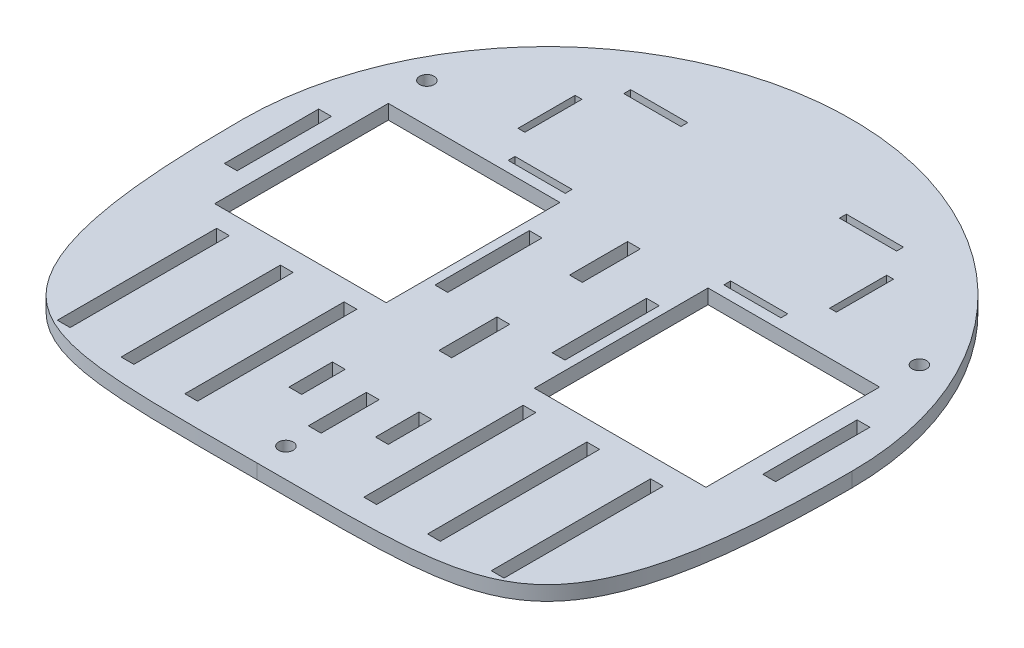
from build123d import *

# Parameters (mm, degrees)
BASE_DEPTH            = 6.35
SKETCH6_W             = 75.0815
SKETCH6_H             = 76
SKETCH6_W_2           = 5.588
SKETCH6_H_2           = 41.275
WHEELSHAFTCUT_DEPTH   = 189.692256213
SKETCH8_W             = 5.588
SKETCH8_H             = 69.7
SKETCH8_H_2           = 19.05
MOTORCUT_DEPTH        = 189.692256213
SKETCH10_W            = 25
SKETCH10_H            = 3
SKETCH10_W_2          = 3
SKETCH10_H_2          = 25
VELCROCUT_DEPTH       = 189.692256213
SKETCH11_R            = 3.175
SCREWCUT_DEPTH        = 189.692256213
SKETCH13_W            = 5.588
SKETCH13_H            = 25.4
SUPPORTSTRUTCUT_DEPTH = 189.692256213


with BuildPart() as part:
    # Sketch1 → Base (new body)
    with BuildSketch(Plane(origin=(0, 0, 0), x_dir=(1, 0, 0), z_dir=(0, 1, 0))):
        with BuildLine():
            ThreePointArc((133.35, 0), (0, 133.35), (-133.35, 0))
            add(Edge.make_bspline(
                [(-133.35, 0), (-133.35, -51.197979728), (-123.803376308, -129.805052089), (-58.427993604, -127), (0, -127)],
                knots=[0, 0, 0, 0, 0.502616309, 1, 1, 1, 1], degree=3))
            add(Edge.make_bspline(
                [(133.35, 0), (133.35, -51.197979728), (123.803376308, -129.805052089), (58.427993604, -127), (0, -127)],
                knots=[0, 0, 0, 0, 0.502616309, 1, 1, 1, 1], degree=3))
        make_face()
    extrude(amount=BASE_DEPTH)

    # Sketch6 → WheelShaftCut (cut, through all)
    with BuildSketch(Plane(origin=(0, 6.35, 0), x_dir=(1, 0, 0), z_dir=(0, 1, 0))):
        with Locations((-69.957348141, 0)):
            Rectangle(SKETCH6_W, SKETCH6_H)
        with Locations((-117.816848141, 0)):
            Rectangle(SKETCH6_W_2, SKETCH6_H_2)
        with Locations((-25.653848141, 0)):
            Rectangle(SKETCH6_W_2, SKETCH6_H_2)
        with Locations((25.653848141, 0)):
            Rectangle(SKETCH6_W_2, SKETCH6_H_2)
        with Locations((117.816848141, 0)):
            Rectangle(SKETCH6_W_2, SKETCH6_H_2)
        with Locations((69.957348141, 0)):
            Rectangle(SKETCH6_W, SKETCH6_H)
    extrude(amount=-WHEELSHAFTCUT_DEPTH, mode=Mode.SUBTRACT)

    # Sketch8 → MotorCut (cut, through all)
    with BuildSketch(Plane(origin=(0, 6.35, 0), x_dir=(1, 0, 0), z_dir=(0, 1, 0))):
        with Locations((-39.174460242, -81.74)):
            Rectangle(SKETCH8_W, SKETCH8_H)
        with Locations((-67.057904192, -81.74)):
            Rectangle(SKETCH8_W, SKETCH8_H)
        with Locations((-94.941348141, -81.74)):
            Rectangle(SKETCH8_W, SKETCH8_H)
        with Locations((18.941348141, -81.74)):
            Rectangle(SKETCH8_W, SKETCH8_H_2)
        with Locations((94.941348141, -81.74)):
            Rectangle(SKETCH8_W, SKETCH8_H)
        with Locations((67.057904192, -81.74)):
            Rectangle(SKETCH8_W, SKETCH8_H)
        with Locations((-18.941348141, -81.74)):
            Rectangle(SKETCH8_W, SKETCH8_H_2)
        with Locations((39.174460242, -81.74)):
            Rectangle(SKETCH8_W, SKETCH8_H)
    extrude(amount=-MOTORCUT_DEPTH, mode=Mode.SUBTRACT)

    # Sketch10 → VelcroCut (cut, through all)
    with BuildSketch(Plane(origin=(0, 6.35, 0), x_dir=(1, 0, 0), z_dir=(0, 1, 0))):
        with Locations((-47.19, 44.12)):
            Rectangle(SKETCH10_W, SKETCH10_H)
        with Locations((-47.19, 94.745)):
            Rectangle(SKETCH10_W, SKETCH10_H)
        with Locations((-68.175, 69.4325)):
            Rectangle(SKETCH10_W_2, SKETCH10_H_2)
        with Locations((68.175, 69.4325)):
            Rectangle(SKETCH10_W_2, SKETCH10_H_2)
        with Locations((47.19, 94.745)):
            Rectangle(SKETCH10_W, SKETCH10_H)
        with Locations((47.19, 44.12)):
            Rectangle(SKETCH10_W, SKETCH10_H)
    extrude(amount=-VELCROCUT_DEPTH, mode=Mode.SUBTRACT)

    # Sketch11 → ScrewCut (cut, through all)
    with BuildSketch(Plane(origin=(0, 6.35, 0), x_dir=(1, 0, 0), z_dir=(0, 1, 0))):
        with Locations((0, -114.3)):
            Circle(SKETCH11_R)
        with Locations((-107.775, 55.145)):
            Circle(SKETCH11_R)
        with Locations((107.775, 55.145)):
            Circle(SKETCH11_R)
    extrude(amount=-SCREWCUT_DEPTH, mode=Mode.SUBTRACT)

    # Sketch13 → SupportStrutCut (cut, through all)
    with BuildSketch(Plane(origin=(0, 6.35, 0), x_dir=(1, 0, 0), z_dir=(0, 1, 0))):
        with Locations((0, 25.3)):
            Rectangle(SKETCH13_W, SKETCH13_H)
        with Locations((0, -31.85)):
            Rectangle(SKETCH13_W, SKETCH13_H)
        with Locations((0, -89)):
            Rectangle(SKETCH13_W, SKETCH13_H)
    extrude(amount=-SUPPORTSTRUTCUT_DEPTH, mode=Mode.SUBTRACT)


solid = part.part
